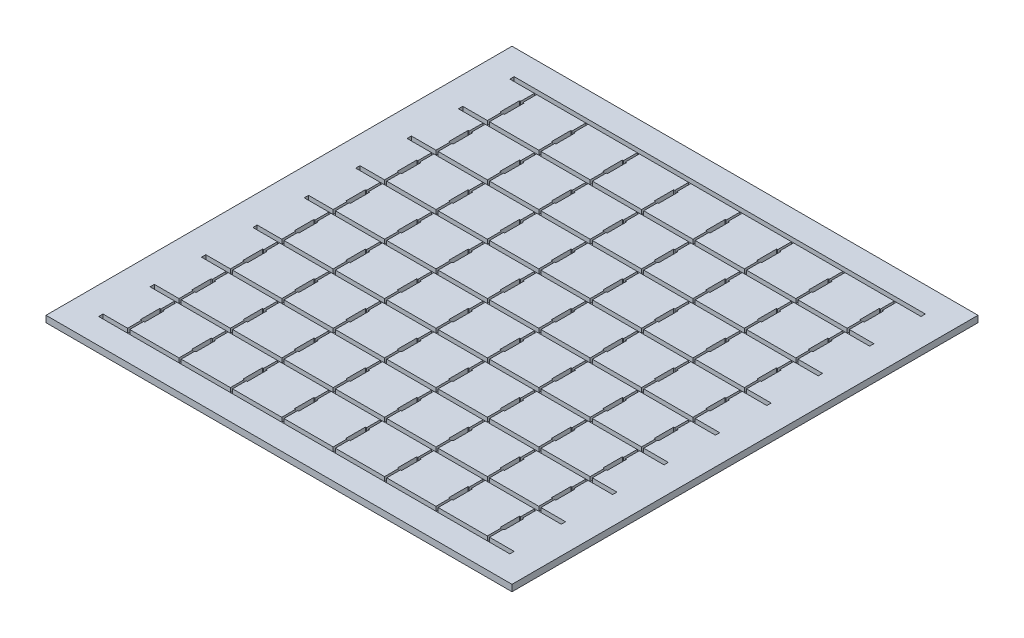
from build123d import *

# Parameters (mm, degrees)
SKETCH1_W           = 431.8
SKETCH1_H           = 431.8
BOSS_EXTRUDE1_DEPTH = 6
CUT_EXTRUDE1_DEPTH  = 4
SKETCH4_W           = 381
SKETCH4_H           = 4
CUT_EXTRUDE2_DEPTH  = 4


with BuildPart() as part:
    # Sketch1 → Boss-Extrude1 (new body)
    with BuildSketch(Plane(origin=(0, 0, 0), x_dir=(1, 0, 0), z_dir=(0, 1, 0))):
        with Locations((215.9, 215.9)):
            Rectangle(SKETCH1_W, SKETCH1_H)
    extrude(amount=BOSS_EXTRUDE1_DEPTH)

    # Sketch2 → Cut-Extrude1 (cut)
    with BuildSketch(Plane(origin=(0, 6, 0), x_dir=(1, 0, 0), z_dir=(0, 1, 0))):
        Polygon((50.2125, 58.2125), (51.2125, 58.2125), (51.2125, 40.2125), (50.2125, 40.2125), (50.2125, 25.4), (48.2125, 25.4), (48.2125, 40.2125), (47.2125, 40.2125), (47.2125, 58.2125), (48.2125, 58.2125), (48.2125, 73.025), (48.2125, 87.8375), (47.2125, 87.8375), (47.2125, 105.8375), (48.2125, 105.8375), (48.2125, 120.65), (48.2125, 135.4625), (47.2125, 135.4625), (47.2125, 153.4625), (48.2125, 153.4625), (48.2125, 168.275), (48.2125, 183.0875), (47.2125, 183.0875), (47.2125, 201.0875), (48.2125, 201.0875), (48.2125, 215.9), (48.2125, 230.7125), (47.2125, 230.7125), (47.2125, 248.7125), (48.2125, 248.7125), (48.2125, 263.525), (48.2125, 278.3375), (47.2125, 278.3375), (47.2125, 296.3375), (48.2125, 296.3375), (48.2125, 311.15), (48.2125, 325.9625), (47.2125, 325.9625), (47.2125, 343.9625), (48.2125, 343.9625), (48.2125, 358.775), (48.2125, 373.5875), (47.2125, 373.5875), (47.2125, 391.5875), (48.2125, 391.5875), (48.2125, 406.4), (50.2125, 406.4), (50.2125, 391.5875), (51.2125, 391.5875), (51.2125, 373.5875), (50.2125, 373.5875), (50.2125, 358.775), (50.2125, 343.9625), (51.2125, 343.9625), (51.2125, 325.9625), (50.2125, 325.9625), (50.2125, 311.15), (50.2125, 296.3375), (51.2125, 296.3375), (51.2125, 278.3375), (50.2125, 278.3375), (50.2125, 263.525), (50.2125, 248.7125), (51.2125, 248.7125), (51.2125, 230.7125), (50.2125, 230.7125), (50.2125, 215.9), (50.2125, 201.0875), (51.2125, 201.0875), (51.2125, 183.0875), (50.2125, 183.0875), (50.2125, 168.275), (50.2125, 153.4625), (51.2125, 153.4625), (51.2125, 135.4625), (50.2125, 135.4625), (50.2125, 120.65), (50.2125, 105.8375), (51.2125, 105.8375), (51.2125, 87.8375), (50.2125, 87.8375), (50.2125, 73.025), align=None)
        Polygon((95.8375, 105.8375), (95.8375, 120.65), (95.8375, 135.4625), (94.8375, 135.4625), (94.8375, 153.4625), (95.8375, 153.4625), (95.8375, 168.275), (95.8375, 183.0875), (94.8375, 183.0875), (94.8375, 201.0875), (95.8375, 201.0875), (95.8375, 215.9), (95.8375, 230.7125), (94.8375, 230.7125), (94.8375, 248.7125), (95.8375, 248.7125), (95.8375, 263.525), (95.8375, 278.3375), (94.8375, 278.3375), (94.8375, 296.3375), (95.8375, 296.3375), (95.8375, 311.15), (95.8375, 325.9625), (94.8375, 325.9625), (94.8375, 343.9625), (95.8375, 343.9625), (95.8375, 358.775), (95.8375, 373.5875), (94.8375, 373.5875), (94.8375, 391.5875), (95.8375, 391.5875), (95.8375, 406.4), (97.8375, 406.4), (97.8375, 391.5875), (98.8375, 391.5875), (98.8375, 373.5875), (97.8375, 373.5875), (97.8375, 358.775), (97.8375, 343.9625), (98.8375, 343.9625), (98.8375, 325.9625), (97.8375, 325.9625), (97.8375, 311.15), (97.8375, 296.3375), (98.8375, 296.3375), (98.8375, 278.3375), (97.8375, 278.3375), (97.8375, 263.525), (97.8375, 248.7125), (98.8375, 248.7125), (98.8375, 230.7125), (97.8375, 230.7125), (97.8375, 215.9), (97.8375, 201.0875), (98.8375, 201.0875), (98.8375, 183.0875), (97.8375, 183.0875), (97.8375, 168.275), (97.8375, 153.4625), (98.8375, 153.4625), (98.8375, 135.4625), (97.8375, 135.4625), (97.8375, 120.65), (97.8375, 105.8375), (98.8375, 105.8375), (98.8375, 87.8375), (97.8375, 87.8375), (97.8375, 73.025), (97.8375, 58.2125), (98.8375, 58.2125), (98.8375, 40.2125), (97.8375, 40.2125), (97.8375, 25.4), (95.8375, 25.4), (95.8375, 40.2125), (94.8375, 40.2125), (94.8375, 58.2125), (95.8375, 58.2125), (95.8375, 73.025), (95.8375, 87.8375), (94.8375, 87.8375), (94.8375, 105.8375), align=None)
        Polygon((143.4625, 105.8375), (143.4625, 120.65), (143.4625, 135.4625), (142.4625, 135.4625), (142.4625, 153.4625), (143.4625, 153.4625), (143.4625, 168.275), (143.4625, 183.0875), (142.4625, 183.0875), (142.4625, 201.0875), (143.4625, 201.0875), (143.4625, 215.9), (143.4625, 230.7125), (142.4625, 230.7125), (142.4625, 248.7125), (143.4625, 248.7125), (143.4625, 263.525), (143.4625, 278.3375), (142.4625, 278.3375), (142.4625, 296.3375), (143.4625, 296.3375), (143.4625, 311.15), (143.4625, 325.9625), (142.4625, 325.9625), (142.4625, 343.9625), (143.4625, 343.9625), (143.4625, 358.775), (143.4625, 373.5875), (142.4625, 373.5875), (142.4625, 391.5875), (143.4625, 391.5875), (143.4625, 406.4), (145.4625, 406.4), (145.4625, 391.5875), (146.4625, 391.5875), (146.4625, 373.5875), (145.4625, 373.5875), (145.4625, 358.775), (145.4625, 343.9625), (146.4625, 343.9625), (146.4625, 325.9625), (145.4625, 325.9625), (145.4625, 311.15), (145.4625, 296.3375), (146.4625, 296.3375), (146.4625, 278.3375), (145.4625, 278.3375), (145.4625, 263.525), (145.4625, 248.7125), (146.4625, 248.7125), (146.4625, 230.7125), (145.4625, 230.7125), (145.4625, 215.9), (145.4625, 201.0875), (146.4625, 201.0875), (146.4625, 183.0875), (145.4625, 183.0875), (145.4625, 168.275), (145.4625, 153.4625), (146.4625, 153.4625), (146.4625, 135.4625), (145.4625, 135.4625), (145.4625, 120.65), (145.4625, 105.8375), (146.4625, 105.8375), (146.4625, 87.8375), (145.4625, 87.8375), (145.4625, 73.025), (145.4625, 58.2125), (146.4625, 58.2125), (146.4625, 40.2125), (145.4625, 40.2125), (145.4625, 25.4), (143.4625, 25.4), (143.4625, 40.2125), (142.4625, 40.2125), (142.4625, 58.2125), (143.4625, 58.2125), (143.4625, 73.025), (143.4625, 87.8375), (142.4625, 87.8375), (142.4625, 105.8375), align=None)
        Polygon((191.0875, 105.8375), (191.0875, 120.65), (191.0875, 135.4625), (190.0875, 135.4625), (190.0875, 153.4625), (191.0875, 153.4625), (191.0875, 168.275), (191.0875, 183.0875), (190.0875, 183.0875), (190.0875, 201.0875), (191.0875, 201.0875), (191.0875, 215.9), (191.0875, 230.7125), (190.0875, 230.7125), (190.0875, 248.7125), (191.0875, 248.7125), (191.0875, 263.525), (191.0875, 278.3375), (190.0875, 278.3375), (190.0875, 296.3375), (191.0875, 296.3375), (191.0875, 311.15), (191.0875, 325.9625), (190.0875, 325.9625), (190.0875, 343.9625), (191.0875, 343.9625), (191.0875, 358.775), (191.0875, 373.5875), (190.0875, 373.5875), (190.0875, 391.5875), (191.0875, 391.5875), (191.0875, 406.4), (193.0875, 406.4), (193.0875, 391.5875), (194.0875, 391.5875), (194.0875, 373.5875), (193.0875, 373.5875), (193.0875, 358.775), (193.0875, 343.9625), (194.0875, 343.9625), (194.0875, 325.9625), (193.0875, 325.9625), (193.0875, 311.15), (193.0875, 296.3375), (194.0875, 296.3375), (194.0875, 278.3375), (193.0875, 278.3375), (193.0875, 263.525), (193.0875, 248.7125), (194.0875, 248.7125), (194.0875, 230.7125), (193.0875, 230.7125), (193.0875, 215.9), (193.0875, 201.0875), (194.0875, 201.0875), (194.0875, 183.0875), (193.0875, 183.0875), (193.0875, 168.275), (193.0875, 153.4625), (194.0875, 153.4625), (194.0875, 135.4625), (193.0875, 135.4625), (193.0875, 120.65), (193.0875, 105.8375), (194.0875, 105.8375), (194.0875, 87.8375), (193.0875, 87.8375), (193.0875, 73.025), (193.0875, 58.2125), (194.0875, 58.2125), (194.0875, 40.2125), (193.0875, 40.2125), (193.0875, 25.4), (191.0875, 25.4), (191.0875, 40.2125), (190.0875, 40.2125), (190.0875, 58.2125), (191.0875, 58.2125), (191.0875, 73.025), (191.0875, 87.8375), (190.0875, 87.8375), (190.0875, 105.8375), align=None)
        Polygon((238.7125, 105.8375), (238.7125, 120.65), (238.7125, 135.4625), (237.7125, 135.4625), (237.7125, 153.4625), (238.7125, 153.4625), (238.7125, 168.275), (238.7125, 183.0875), (237.7125, 183.0875), (237.7125, 201.0875), (238.7125, 201.0875), (238.7125, 215.9), (238.7125, 230.7125), (237.7125, 230.7125), (237.7125, 248.7125), (238.7125, 248.7125), (238.7125, 263.525), (238.7125, 278.3375), (237.7125, 278.3375), (237.7125, 296.3375), (238.7125, 296.3375), (238.7125, 311.15), (238.7125, 325.9625), (237.7125, 325.9625), (237.7125, 343.9625), (238.7125, 343.9625), (238.7125, 358.775), (238.7125, 373.5875), (237.7125, 373.5875), (237.7125, 391.5875), (238.7125, 391.5875), (238.7125, 406.4), (240.7125, 406.4), (240.7125, 391.5875), (241.7125, 391.5875), (241.7125, 373.5875), (240.7125, 373.5875), (240.7125, 358.775), (240.7125, 343.9625), (241.7125, 343.9625), (241.7125, 325.9625), (240.7125, 325.9625), (240.7125, 311.15), (240.7125, 296.3375), (241.7125, 296.3375), (241.7125, 278.3375), (240.7125, 278.3375), (240.7125, 263.525), (240.7125, 248.7125), (241.7125, 248.7125), (241.7125, 230.7125), (240.7125, 230.7125), (240.7125, 215.9), (240.7125, 201.0875), (241.7125, 201.0875), (241.7125, 183.0875), (240.7125, 183.0875), (240.7125, 168.275), (240.7125, 153.4625), (241.7125, 153.4625), (241.7125, 135.4625), (240.7125, 135.4625), (240.7125, 120.65), (240.7125, 105.8375), (241.7125, 105.8375), (241.7125, 87.8375), (240.7125, 87.8375), (240.7125, 73.025), (240.7125, 58.2125), (241.7125, 58.2125), (241.7125, 40.2125), (240.7125, 40.2125), (240.7125, 25.4), (238.7125, 25.4), (238.7125, 40.2125), (237.7125, 40.2125), (237.7125, 58.2125), (238.7125, 58.2125), (238.7125, 73.025), (238.7125, 87.8375), (237.7125, 87.8375), (237.7125, 105.8375), align=None)
        Polygon((286.3375, 105.8375), (286.3375, 120.65), (286.3375, 135.4625), (285.3375, 135.4625), (285.3375, 153.4625), (286.3375, 153.4625), (286.3375, 168.275), (286.3375, 183.0875), (285.3375, 183.0875), (285.3375, 201.0875), (286.3375, 201.0875), (286.3375, 215.9), (286.3375, 230.7125), (285.3375, 230.7125), (285.3375, 248.7125), (286.3375, 248.7125), (286.3375, 263.525), (286.3375, 278.3375), (285.3375, 278.3375), (285.3375, 296.3375), (286.3375, 296.3375), (286.3375, 311.15), (286.3375, 325.9625), (285.3375, 325.9625), (285.3375, 343.9625), (286.3375, 343.9625), (286.3375, 358.775), (286.3375, 373.5875), (285.3375, 373.5875), (285.3375, 391.5875), (286.3375, 391.5875), (286.3375, 406.4), (288.3375, 406.4), (288.3375, 391.5875), (289.3375, 391.5875), (289.3375, 373.5875), (288.3375, 373.5875), (288.3375, 358.775), (288.3375, 343.9625), (289.3375, 343.9625), (289.3375, 325.9625), (288.3375, 325.9625), (288.3375, 311.15), (288.3375, 296.3375), (289.3375, 296.3375), (289.3375, 278.3375), (288.3375, 278.3375), (288.3375, 263.525), (288.3375, 248.7125), (289.3375, 248.7125), (289.3375, 230.7125), (288.3375, 230.7125), (288.3375, 215.9), (288.3375, 201.0875), (289.3375, 201.0875), (289.3375, 183.0875), (288.3375, 183.0875), (288.3375, 168.275), (288.3375, 153.4625), (289.3375, 153.4625), (289.3375, 135.4625), (288.3375, 135.4625), (288.3375, 120.65), (288.3375, 105.8375), (289.3375, 105.8375), (289.3375, 87.8375), (288.3375, 87.8375), (288.3375, 73.025), (288.3375, 58.2125), (289.3375, 58.2125), (289.3375, 40.2125), (288.3375, 40.2125), (288.3375, 25.4), (286.3375, 25.4), (286.3375, 40.2125), (285.3375, 40.2125), (285.3375, 58.2125), (286.3375, 58.2125), (286.3375, 73.025), (286.3375, 87.8375), (285.3375, 87.8375), (285.3375, 105.8375), align=None)
        Polygon((333.9625, 105.8375), (333.9625, 120.65), (333.9625, 135.4625), (332.9625, 135.4625), (332.9625, 153.4625), (333.9625, 153.4625), (333.9625, 168.275), (333.9625, 183.0875), (332.9625, 183.0875), (332.9625, 201.0875), (333.9625, 201.0875), (333.9625, 215.9), (333.9625, 230.7125), (332.9625, 230.7125), (332.9625, 248.7125), (333.9625, 248.7125), (333.9625, 263.525), (333.9625, 278.3375), (332.9625, 278.3375), (332.9625, 296.3375), (333.9625, 296.3375), (333.9625, 311.15), (333.9625, 325.9625), (332.9625, 325.9625), (332.9625, 343.9625), (333.9625, 343.9625), (333.9625, 358.775), (333.9625, 373.5875), (332.9625, 373.5875), (332.9625, 391.5875), (333.9625, 391.5875), (333.9625, 406.4), (335.9625, 406.4), (335.9625, 391.5875), (336.9625, 391.5875), (336.9625, 373.5875), (335.9625, 373.5875), (335.9625, 358.775), (335.9625, 343.9625), (336.9625, 343.9625), (336.9625, 325.9625), (335.9625, 325.9625), (335.9625, 311.15), (335.9625, 296.3375), (336.9625, 296.3375), (336.9625, 278.3375), (335.9625, 278.3375), (335.9625, 263.525), (335.9625, 248.7125), (336.9625, 248.7125), (336.9625, 230.7125), (335.9625, 230.7125), (335.9625, 215.9), (335.9625, 201.0875), (336.9625, 201.0875), (336.9625, 183.0875), (335.9625, 183.0875), (335.9625, 168.275), (335.9625, 153.4625), (336.9625, 153.4625), (336.9625, 135.4625), (335.9625, 135.4625), (335.9625, 120.65), (335.9625, 105.8375), (336.9625, 105.8375), (336.9625, 87.8375), (335.9625, 87.8375), (335.9625, 73.025), (335.9625, 58.2125), (336.9625, 58.2125), (336.9625, 40.2125), (335.9625, 40.2125), (335.9625, 25.4), (333.9625, 25.4), (333.9625, 40.2125), (332.9625, 40.2125), (332.9625, 58.2125), (333.9625, 58.2125), (333.9625, 73.025), (333.9625, 87.8375), (332.9625, 87.8375), (332.9625, 105.8375), align=None)
        Polygon((381.5875, 105.8375), (381.5875, 120.65), (381.5875, 135.4625), (380.5875, 135.4625), (380.5875, 153.4625), (381.5875, 153.4625), (381.5875, 168.275), (381.5875, 183.0875), (380.5875, 183.0875), (380.5875, 201.0875), (381.5875, 201.0875), (381.5875, 215.9), (381.5875, 230.7125), (380.5875, 230.7125), (380.5875, 248.7125), (381.5875, 248.7125), (381.5875, 263.525), (381.5875, 278.3375), (380.5875, 278.3375), (380.5875, 296.3375), (381.5875, 296.3375), (381.5875, 311.15), (381.5875, 325.9625), (380.5875, 325.9625), (380.5875, 343.9625), (381.5875, 343.9625), (381.5875, 358.775), (381.5875, 373.5875), (380.5875, 373.5875), (380.5875, 391.5875), (381.5875, 391.5875), (381.5875, 406.4), (383.5875, 406.4), (383.5875, 391.5875), (384.5875, 391.5875), (384.5875, 373.5875), (383.5875, 373.5875), (383.5875, 358.775), (383.5875, 343.9625), (384.5875, 343.9625), (384.5875, 325.9625), (383.5875, 325.9625), (383.5875, 311.15), (383.5875, 296.3375), (384.5875, 296.3375), (384.5875, 278.3375), (383.5875, 278.3375), (383.5875, 263.525), (383.5875, 248.7125), (384.5875, 248.7125), (384.5875, 230.7125), (383.5875, 230.7125), (383.5875, 215.9), (383.5875, 201.0875), (384.5875, 201.0875), (384.5875, 183.0875), (383.5875, 183.0875), (383.5875, 168.275), (383.5875, 153.4625), (384.5875, 153.4625), (384.5875, 135.4625), (383.5875, 135.4625), (383.5875, 120.65), (383.5875, 105.8375), (384.5875, 105.8375), (384.5875, 87.8375), (383.5875, 87.8375), (383.5875, 73.025), (383.5875, 58.2125), (384.5875, 58.2125), (384.5875, 40.2125), (383.5875, 40.2125), (383.5875, 25.4), (381.5875, 25.4), (381.5875, 40.2125), (380.5875, 40.2125), (380.5875, 58.2125), (381.5875, 58.2125), (381.5875, 73.025), (381.5875, 87.8375), (380.5875, 87.8375), (380.5875, 105.8375), align=None)
    extrude(amount=-CUT_EXTRUDE1_DEPTH, mode=Mode.SUBTRACT)

    # Sketch4 → Cut-Extrude2 (cut)
    with BuildSketch(Plane(origin=(0, 6, 0), x_dir=(1, 0, 0), z_dir=(0, 1, 0))):
        with Locations((215.9, 406.4)):
            Rectangle(SKETCH4_W, SKETCH4_H)
        with Locations((215.9, 358.775)):
            Rectangle(SKETCH4_W, SKETCH4_H)
        with Locations((215.9, 311.15)):
            Rectangle(SKETCH4_W, SKETCH4_H)
        with Locations((215.9, 263.525)):
            Rectangle(SKETCH4_W, SKETCH4_H)
        with Locations((215.9, 215.9)):
            Rectangle(SKETCH4_W, SKETCH4_H)
        with Locations((215.9, 168.275)):
            Rectangle(SKETCH4_W, SKETCH4_H)
        with Locations((215.9, 120.65)):
            Rectangle(SKETCH4_W, SKETCH4_H)
        with Locations((215.9, 73.025)):
            Rectangle(SKETCH4_W, SKETCH4_H)
        with Locations((215.9, 25.4)):
            Rectangle(SKETCH4_W, SKETCH4_H)
    extrude(amount=-CUT_EXTRUDE2_DEPTH, mode=Mode.SUBTRACT)


solid = part.part
